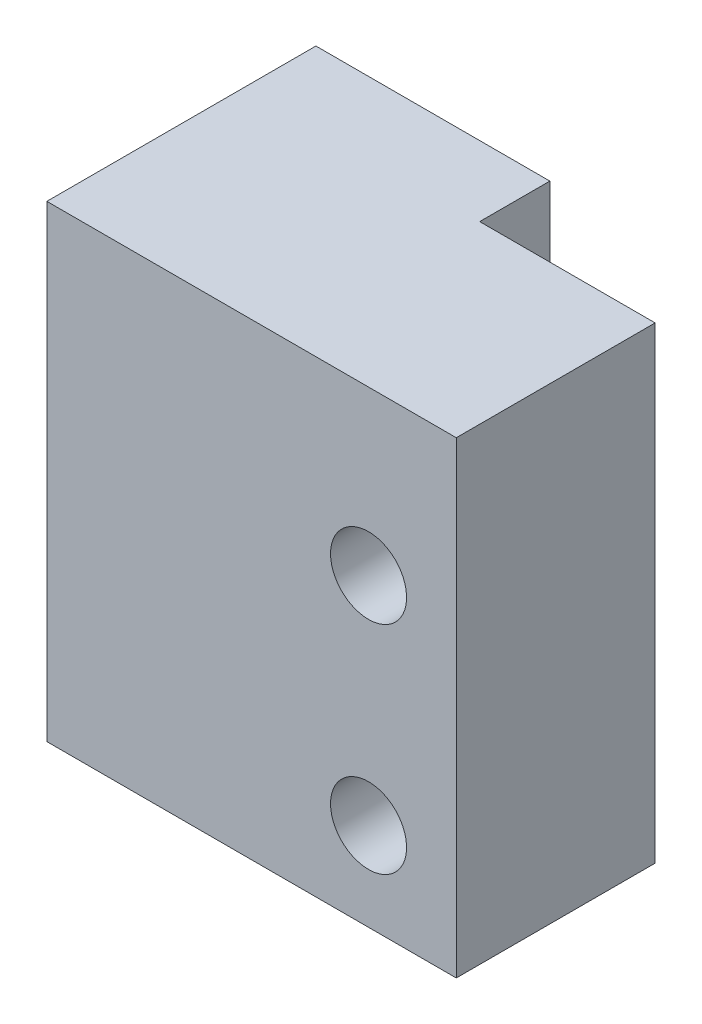
from build123d import *

# Parameters (mm, degrees)
BOSS_EXTRUDE2_DEPTH = 40
SKETCH3_R           = 4
CUT_EXTRUDE1_DEPTH  = 35
CUT_EXTRUDE2_REACH  = 52.14
SKETCH4_R           = 3.25


with BuildPart() as part:
    # Sketch1 → Boss-Extrude2 (new body)
    with BuildSketch(Plane(origin=(0, 0, 0), x_dir=(1, 0, 0), z_dir=(0, 1, 0))):
        Polygon((-10, -5.257459708), (-10, 0.742540292), (10, 0.742540292), (10, -5.257459708), (25, -5.257459708), (25, -22.257459708), (-10, -22.257459708), align=None)
    extrude(amount=BOSS_EXTRUDE2_DEPTH)

    # Sketch3 → Cut-Extrude1 (cut)
    with BuildSketch(Plane.XZ):
        with Locations((0, 9.257459708)):
            Circle(SKETCH3_R)
    extrude(amount=-CUT_EXTRUDE1_DEPTH, mode=Mode.SUBTRACT)

    # Sketch4 → Cut-Extrude2 (cut, up to next)
    with BuildSketch(Plane(origin=(0, 0, 5.257459708), x_dir=(-1, 0, 0), z_dir=(0, 0, -1)), mode=Mode.PRIVATE) as cut_extrude2_sk1:
        with Locations((-17.5, 26.045770547)):
            Circle(SKETCH4_R)
    cut_extrude2_tool1 = extrude(cut_extrude2_sk1.sketch, amount=-CUT_EXTRUDE2_REACH, mode=Mode.PRIVATE) & part.part
    # Sketch4 → Cut-Extrude2 (cut, up to next)
    with BuildSketch(Plane(origin=(0, 0, 5.257459708), x_dir=(-1, 0, 0), z_dir=(0, 0, -1)), mode=Mode.PRIVATE) as cut_extrude2_sk2:
        with Locations((-17.5, 7.535290978)):
            Circle(SKETCH4_R)
    cut_extrude2_tool2 = extrude(cut_extrude2_sk2.sketch, amount=-CUT_EXTRUDE2_REACH, mode=Mode.PRIVATE) & part.part
    add(cut_extrude2_tool1.solids().sort_by_distance((17.5, 26.045771, 5.25746))[0], mode=Mode.SUBTRACT)
    add(cut_extrude2_tool2.solids().sort_by_distance((17.5, 7.535291, 5.25746))[0], mode=Mode.SUBTRACT)


solid = part.part
